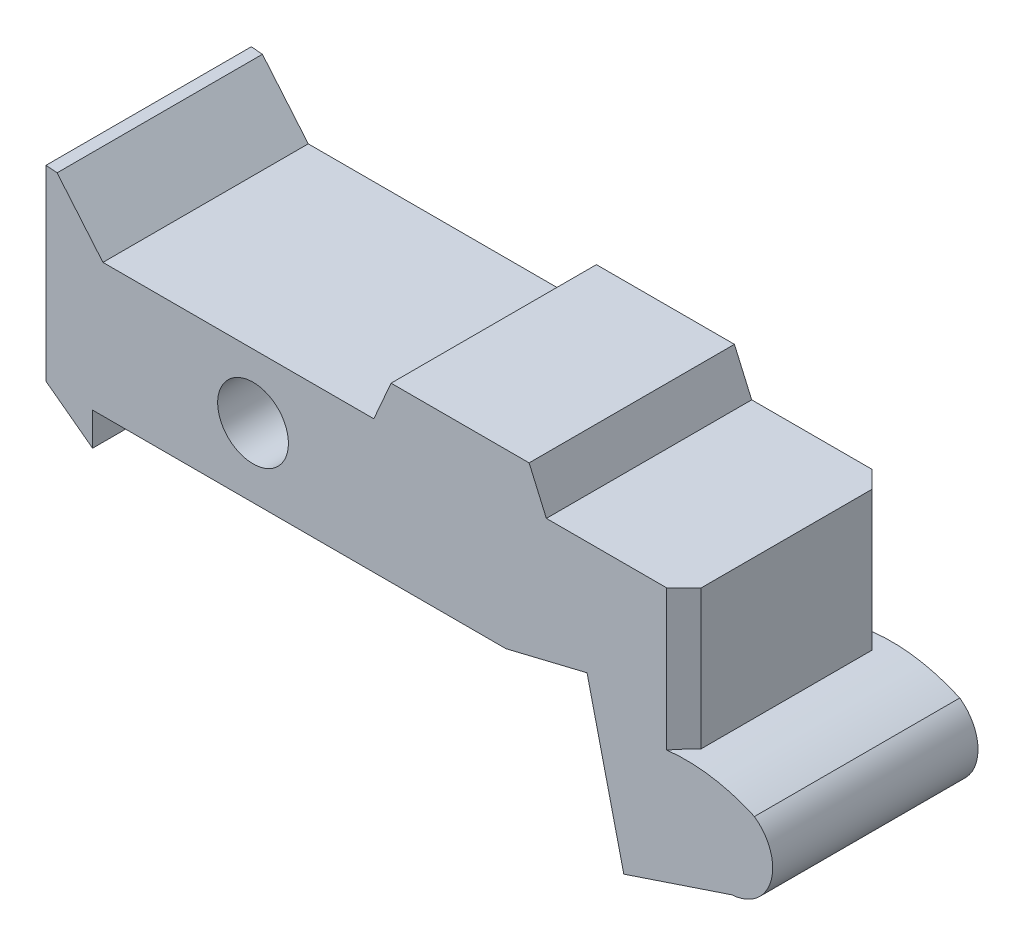
from build123d import *

# Parameters (mm, degrees)
SKETCH_1_R          = 2.05
EXTRUDE_1_DEPTH     = 5.95
SKETCH_2_R          = 5
SKETCH_2_R_2        = 4.3
CUT_EXTRUDE_1_DEPTH = 3
FILLET_1_R          = 1
CHAMFER_2_SIZE      = 1
CHAMFER_3_SIZE      = 1
CHAMFER_3_SIZE2     = 0.709809686


with BuildPart() as part:
    # 스케치1 → 보스-돌출1 (new, symmetric)
    with BuildSketch(Plane.XY):
        with BuildLine():
            Line((-9.3, -4), (-9.3, -5.916283943))
            Line((-9.3, -5.916283943), (-12, -3.906505398))
            Line((-12, -3.906505398), (-12, 4.145721859))
            Line((-12, 4.145721859), (-12, 7.645721859))
            Line((-12, 7.645721859), (-8.7, 3.712694326))
            Line((-8.7, 3.712694326), (7, 3.712694326))
            Line((7, 3.712694326), (8, 6))
            Line((8, 6), (16, 6))
            Line((16, 6), (17, 3.712694326))
            Line((17, 3.712694326), (20, 3.712694326))
            Line((20, 3.712694326), (24.97481487, 3.712694326))
            Line((24.97481487, 3.712694326), (24.97481487, -4.364515181))
            ThreePointArc((24.97481487, -4.364515181), (27.06415919, -4.568973756), (29.05933214, -5.222003534))
            ThreePointArc((29.05933214, -5.222003534), (30.020110844, -7.978170358), (27.746673373, -9.808753146))
            Line((27.746673373, -9.808753146), (21.488254287, -11.89950036))
            Line((21.488254287, -11.89950036), (19.357468482, -2.858721645))
            Line((19.357468482, -2.858721645), (14.656995804, -4))
            Line((14.656995804, -4), (13.992506615, -4))
            Line((13.992506615, -4), (-9.3, -4))
        make_face()
        Circle(SKETCH_1_R, mode=Mode.SUBTRACT)
    extrude(amount=EXTRUDE_1_DEPTH, both=True)

    # 스케치2 → 컷-돌출1 (cut)
    with BuildSketch(Plane.XZ.offset(4)):
        with Locations(Location((13, 0, 0), (0, 0, 270))):
            Circle(SKETCH_2_R)
        with Locations(Location((13, 0, 0), (0, 0, 270))):
            Circle(SKETCH_2_R_2, mode=Mode.SUBTRACT)
    extrude(amount=-CUT_EXTRUDE_1_DEPTH, mode=Mode.SUBTRACT)

    # 필렛1
    # the kernel refuses this fillet: 1 mm, written as the material it takes off along each edge
    with BuildSketch(Plane(origin=(13, -4, 0), x_dir=(0.9752421696657375, 0, -0.22113957245519109), z_dir=(-0.22113957245519109, 0, -0.9752421696657375))) as fillet_1_piece_1:
        with BuildLine():
            CenterArc((4.3 - FILLET_1_R, -FILLET_1_R), FILLET_1_R, 0, 90)
            Line((4.3 - FILLET_1_R, 0), (4.3 - FILLET_1_R, FILLET_1_R * 0.02))
            Line((4.3 - FILLET_1_R, FILLET_1_R * 0.02), (4.3 + FILLET_1_R * 0.02, FILLET_1_R * 0.02))
            Line((4.3 + FILLET_1_R * 0.02, FILLET_1_R * 0.02), (4.3 + FILLET_1_R * 0.02, -FILLET_1_R))
            Line((4.3 + FILLET_1_R * 0.02, -FILLET_1_R), (4.3, -FILLET_1_R))
        make_face()
    revolve(axis=Axis((13, -4, 0), (0, -1, 0)), revolution_arc=282.775974377, mode=Mode.SUBTRACT)
    with BuildSketch(Plane(origin=(13, -4, 0), x_dir=(0, 0, -1), z_dir=(-1, 0, 0))) as fillet_1_piece_2:
        with BuildLine():
            CenterArc((4.3 - FILLET_1_R, -FILLET_1_R), FILLET_1_R, 0, 90)
            Line((4.3 - FILLET_1_R, 0), (4.3 - FILLET_1_R, FILLET_1_R * 0.02))
            Line((4.3 - FILLET_1_R, FILLET_1_R * 0.02), (4.3 + FILLET_1_R * 0.02, FILLET_1_R * 0.02))
            Line((4.3 + FILLET_1_R * 0.02, FILLET_1_R * 0.02), (4.3 + FILLET_1_R * 0.02, -FILLET_1_R))
            Line((4.3 + FILLET_1_R * 0.02, -FILLET_1_R), (4.3, -FILLET_1_R))
        make_face()
    revolve(axis=Axis((13, -4, 0), (0, -1, 0)), revolution_arc=102.614973236, mode=Mode.SUBTRACT)

    # 모따기2
    chamfer_2_edges = [part.edges().sort_by_distance(p)[0] for p in [
        (24.97481487, -0.325910428, -5.95),
        (24.97481487, -0.325910428, 5.95),
    ]]
    chamfer(chamfer_2_edges, length=CHAMFER_2_SIZE)

    # 모따기3
    chamfer_3_edges = [part.edges().sort_by_distance(p)[0] for p in [
        (-12, 7.645721859, 0),
    ]]
    chamfer_3_side = [part.faces().sort_by_distance(p)[0] for p in [
        (-10.35, 5.679208093, 0),
    ]]
    chamfer(chamfer_3_edges, length=CHAMFER_3_SIZE, length2=CHAMFER_3_SIZE2, reference=chamfer_3_side[0])


solid = part.part
